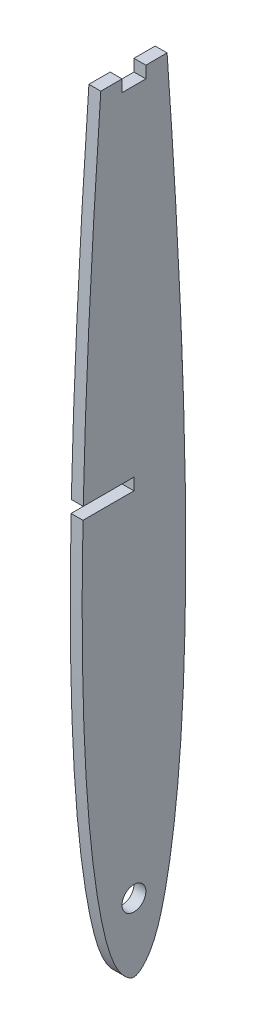
from build123d import *

# Parameters (mm, degrees)
EXTRUDE_1_DEPTH         = 2
CUT_EXTRUDE_START       = -2
CUT_EXTRUDE_1_OUTLINE_R = 2
CUT_EXTRUDE_1_DEPTH     = 2


# Read off the part's stored shape, not the designer's step: 切除-拉伸1
with BuildPart() as part:
    # 草图1 → 凸台-拉伸1 (new body)
    with BuildSketch(Plane(origin=(0, 0, 0), x_dir=(0, 0, -1), z_dir=(1, 0, 0))):
        with BuildLine():
            add(Edge.make_bspline(
                [(0, 193), (-0.012288284, 193), (-0.036860363, 192.682209119), (-0.073603598, 192.460340025), (-0.134145604, 191.982517083), (-0.216837903, 191.357126895), (-0.320148772, 190.531582795), (-0.442734222, 189.535054466), (-0.583708338, 188.359470773), (-0.741224015, 187.007350916), (-0.91342743, 185.485486569), (-1.098367032, 183.794042277), (-1.295153474, 181.932788993), (-1.503001463, 179.912860559), (-1.722142684, 177.734330299), (-1.951645546, 175.397073133), (-2.189862364, 172.914023799), (-2.436037979, 170.28517003), (-2.689763937, 167.510432908), (-2.949769263, 164.606175429), (-3.216039401, 161.572442464), (-3.488047586, 158.409161795), (-3.764070677, 155.134176566), (-4.043757612, 151.747511152), (-4.326255141, 148.249059823), (-4.609441768, 144.658859051), (-4.892481807, 140.976882583), (-5.174863501, 137.20308085), (-5.454691966, 133.359174667), (-5.731636208, 129.445182711), (-6.004663443, 125.461027301), (-6.271447257, 121.429287101), (-6.531172087, 117.349948117), (-6.782917884, 113.222962102), (-7.024648371, 109.072183193), (-7.255701434, 104.897612739), (-7.474940032, 100.699220215), (-7.679991999, 96.500812992), (-7.870083896, 92.302403851), (-8.044216273, 88.103993125), (-8.200659206, 83.929344542), (-8.338917914, 79.778489584), (-8.457541038, 75.651485195), (-8.538807898, 72.228525811), (-8.592437236, 69.509703707), (-8.626639137, 67.495423053), (-8.65491323, 65.495919754), (-8.677150684, 63.511211116), (-8.693364484, 61.541315238), (-8.703342087, 59.588985896), (-8.707094981, 57.65423498), (-8.70416559, 55.737088716), (-8.694147501, 53.840077973), (-8.676636137, 51.963218651), (-8.652114277, 50.106548117), (-8.620905719, 48.272790784), (-8.583512891, 46.461970379), (-8.539492523, 44.674120145), (-8.488374712, 42.911972119), (-8.429886653, 41.175558617), (-8.364375531, 39.464915618), (-8.291893829, 37.782113513), (-8.212897106, 36.127162371), (-8.127038802, 34.500129191), (-8.034038273, 32.903290152), (-7.933854661, 31.336686835), (-7.826611275, 29.800367448), (-7.712449105, 28.296372863), (-7.591658572, 26.824726145), (-7.4640673, 25.385515918), (-7.329411875, 23.980771462), (-7.187764067, 22.610559791), (-7.039458689, 21.274927209), (-6.884625469, 19.975944864), (-6.723768994, 18.713621105), (-6.557419856, 17.487989507), (-6.385750528, 16.300272749), (-6.209456896, 15.150457547), (-6.028620184, 14.038630129), (-5.842946286, 12.966402663), (-5.653007841, 11.933787905), (-5.458792398, 10.940905593), (-5.259967948, 9.989173646), (-5.057199181, 9.078608267), (-4.84951644, 8.209636835), (-4.635268995, 7.382464783), (-4.414704057, 6.597361178), (-4.187298343, 5.854834196), (-3.951488141, 5.1553355), (-3.708306212, 4.499219664), (-3.457504838, 3.88735236), (-3.196526443, 3.319048044), (-2.927146299, 2.794798361), (-2.650818291, 2.315014682), (-2.367000425, 1.880667992), (-2.0794803, 1.491615537), (-1.792593552, 1.14703863), (-1.50916051, 0.848541142), (-1.234038339, 0.5935698), (-0.966592418, 0.382804324), (-0.705813073, 0.218534665), (-0.459755647, 0.097332853), (-0.234428055, 0.020960156), (0, -0.01036), (0.234428055, 0.020960156), (0.459755647, 0.097332853), (0.705813073, 0.218534665), (0.966592418, 0.382804324), (1.234038339, 0.5935698), (1.50916051, 0.848541142), (1.792593552, 1.14703863), (2.0794803, 1.491615537), (2.367000425, 1.880667992), (2.650818291, 2.315014682), (2.927146299, 2.794798361), (3.196526443, 3.319048044), (3.457504838, 3.88735236), (3.708306212, 4.499219664), (3.951488141, 5.1553355), (4.187298343, 5.854834196), (4.414704057, 6.597361178), (4.635268995, 7.382464783), (4.84951644, 8.209636835), (5.057199181, 9.078608267), (5.259967948, 9.989173646), (5.458792398, 10.940905593), (5.653007841, 11.933787905), (5.842946286, 12.966402663), (6.028620184, 14.038630129), (6.209456896, 15.150457547), (6.385750528, 16.300272749), (6.557419856, 17.487989507), (6.723768994, 18.713621105), (6.884625469, 19.975944864), (7.039458689, 21.274927209), (7.187764067, 22.610559791), (7.329411875, 23.980771462), (7.4640673, 25.385515918), (7.591658572, 26.824726145), (7.712449105, 28.296372863), (7.826611275, 29.800367448), (7.933854661, 31.336686835), (8.034038273, 32.903290152), (8.127038802, 34.500129191), (8.212897106, 36.127162371), (8.291893829, 37.782113513), (8.364375531, 39.464915618), (8.429886653, 41.175558617), (8.488374712, 42.911972119), (8.539492523, 44.674120145), (8.583512891, 46.461970379), (8.620905719, 48.272790784), (8.652114277, 50.106548117), (8.676636137, 51.963218651), (8.694147501, 53.840077973), (8.70416559, 55.737088716), (8.707094981, 57.65423498), (8.703342087, 59.588985896), (8.693364484, 61.541315238), (8.677150684, 63.511211116), (8.65491323, 65.495919754), (8.626639137, 67.495423053), (8.592437236, 69.509703707), (8.538807898, 72.228525811), (8.457541038, 75.651485195), (8.338917914, 79.778489584), (8.200659206, 83.929344542), (8.044216273, 88.103993125), (7.870083896, 92.302403851), (7.679991999, 96.500812992), (7.474940032, 100.699220215), (7.255701434, 104.897612739), (7.024648371, 109.072183193), (6.782917884, 113.222962102), (6.531172087, 117.349948117), (6.271447257, 121.429287101), (6.004663443, 125.461027301), (5.731636208, 129.445182711), (5.454691966, 133.359174667), (5.174863501, 137.20308085), (4.892481807, 140.976882583), (4.609441768, 144.658859051), (4.326255141, 148.249059823), (4.043757612, 151.747511152), (3.764070677, 155.134176566), (3.488047586, 158.409161795), (3.216039401, 161.572442464), (2.949769263, 164.606175429), (2.689763937, 167.510432908), (2.436037979, 170.28517003), (2.189862364, 172.914023799), (1.951645546, 175.397073133), (1.722142684, 177.734330299), (1.503001463, 179.912860559), (1.295153474, 181.932788993), (1.098367032, 183.794042277), (0.91342743, 185.485486569), (0.741224015, 187.007350916), (0.583708338, 188.359470773), (0.442734222, 189.535054466), (0.320148772, 190.531582795), (0.216837903, 191.357126895), (0.134145604, 191.982517083), (0.073603598, 192.460340025), (0.036860363, 192.682209119), (0.012288284, 193), (0, 193)],
                knots=[0, 0, 0, 0, 0.000711186, 0.001422112, 0.002133252, 0.004251581, 0.006369198, 0.008487526, 0.011973078, 0.015457521, 0.018943038, 0.023734754, 0.028524887, 0.033316573, 0.039329174, 0.045339833, 0.051352399, 0.058485874, 0.06561704, 0.072750533, 0.080878992, 0.089004858, 0.097133325, 0.106119171, 0.115102078, 0.124087938, 0.133776582, 0.143462084, 0.153150736, 0.163374861, 0.173595632, 0.183819726, 0.194405238, 0.20498727, 0.215572756, 0.226336088, 0.237095883, 0.247859171, 0.25861711, 0.269371511, 0.28012949, 0.290699718, 0.301266554, 0.311836761, 0.316994414, 0.322150426, 0.327308111, 0.332351582, 0.337393397, 0.342436877, 0.347345125, 0.352251772, 0.357160037, 0.361913828, 0.366666143, 0.371419983, 0.375998605, 0.380575696, 0.385154319, 0.389537078, 0.393918407, 0.398301185, 0.402472485, 0.406642416, 0.410813696, 0.4147565, 0.418698025, 0.422640862, 0.426339932, 0.430037815, 0.433736878, 0.437177346, 0.44061666, 0.444057116, 0.447223686, 0.450389262, 0.45355583, 0.4564397, 0.459322619, 0.462206438, 0.464796512, 0.467385721, 0.469975829, 0.472263129, 0.474549689, 0.476836911, 0.478824757, 0.480812048, 0.482800105, 0.484492893, 0.486185006, 0.487877314, 0.489293868, 0.490710107, 0.49212745, 0.493276037, 0.494423523, 0.495568649, 0.496434714, 0.497302284, 0.498179926, 0.498796407, 0.499405099, 0.5, 0.500594901, 0.501203593, 0.501820074, 0.502697716, 0.503565286, 0.504431351, 0.505576477, 0.506723963, 0.50787255, 0.509289893, 0.510706132, 0.512122686, 0.513814994, 0.515507107, 0.517199895, 0.519187952, 0.521175243, 0.523163089, 0.525450311, 0.527736871, 0.530024171, 0.532614279, 0.535203488, 0.537793562, 0.540677381, 0.5435603, 0.54644417, 0.549610738, 0.552776314, 0.555942884, 0.55938334, 0.562822654, 0.566263122, 0.569962185, 0.573660068, 0.577359138, 0.581301975, 0.5852435, 0.589186304, 0.593357584, 0.597527515, 0.601698815, 0.606081593, 0.610462922, 0.614845681, 0.619424304, 0.624001395, 0.628580017, 0.633333857, 0.638086172, 0.642839963, 0.647748228, 0.652654875, 0.657563123, 0.662606603, 0.667648418, 0.672691889, 0.677849574, 0.683005586, 0.688163239, 0.698733446, 0.709300282, 0.71987051, 0.730628489, 0.74138289, 0.752140829, 0.762904117, 0.773663912, 0.784427244, 0.79501273, 0.805594762, 0.816180274, 0.826404368, 0.836625139, 0.846849264, 0.856537916, 0.866223418, 0.875912062, 0.884897922, 0.893880829, 0.902866675, 0.910995142, 0.919121008, 0.927249467, 0.93438296, 0.941514126, 0.948647601, 0.954660167, 0.960670826, 0.966683427, 0.971475113, 0.976265246, 0.981056962, 0.984542479, 0.988026922, 0.991512474, 0.993630802, 0.995748419, 0.997866748, 0.998577888, 0.999288814, 1, 1, 1, 1], degree=3))
        make_face()
    extrude(amount=EXTRUDE_1_DEPTH)

    # 切除-拉伸1 outline → 切除-拉伸1 (cut)
    with BuildSketch(Plane(origin=(2, 0, 0), x_dir=(0, 0, -1), z_dir=(1, 0, 0)).offset(CUT_EXTRUDE_START)):
        with BuildLine():
            Line((0, 72.763840152), (-8.524733292, 72.763840152))
            add(Edge.make_bspline(
                [(-8.524733292, 72.763840152), (-8.53409331, 72.350520598), (-8.548661876, 71.683860649), (-8.562358996, 71.017182624), (-8.567436088, 70.763840152)],
                knots=[0.308661766, 0.308661766, 0.308661766, 0.308661766, 0.311836761, 0.313782754, 0.313782754, 0.313782754, 0.313782754], degree=3))
            Line((-8.567436088, 70.763840152), (0, 70.763840152))
            Line((0, 70.763840152), (0, 72.763840152))
        make_face()
        with BuildLine():
            add(Edge.make_bspline(
                [(0, 193), (-0.012288284, 193), (-0.036860363, 192.682209119), (-0.073603598, 192.460340025), (-0.134145604, 191.982517083), (-0.216837903, 191.357126895), (-0.320148772, 190.531582795), (-0.442734222, 189.535054466), (-0.583708338, 188.359470773), (-0.741224015, 187.007350916), (-0.91342743, 185.485486569), (-1.098367032, 183.794042277), (-1.295153474, 181.932788993), (-1.503001463, 179.912860559), (-1.722142684, 177.734330299), (-1.951645546, 175.397073133), (-2.189862364, 172.914023799), (-2.436037979, 170.28517003), (-2.689763937, 167.510432908), (-2.949769263, 164.606175429), (-3.216039401, 161.572442464), (-3.488047586, 158.409161795), (-3.764070677, 155.134176566), (-4.043757612, 151.747511152), (-4.326255141, 148.249059823), (-4.609441768, 144.658859051), (-4.892481807, 140.976882583), (-5.174863501, 137.20308085), (-5.399572783, 134.116327682), (-5.530087414, 132.287234714), (-5.570547263, 131.716510892)],
                knots=[0, 0, 0, 0, 0.000711186, 0.001422112, 0.002133252, 0.004251581, 0.006369198, 0.008487526, 0.011973078, 0.015457521, 0.018943038, 0.023734754, 0.028524887, 0.033316573, 0.039329174, 0.045339833, 0.051352399, 0.058485874, 0.06561704, 0.072750533, 0.080878992, 0.089004858, 0.097133325, 0.106119171, 0.115102078, 0.124087938, 0.133776582, 0.143462084, 0.153150736, 0.157544743, 0.157544743, 0.157544743, 0.157544743], degree=3))
            Line((-5.570547263, 131.716510892), (-2, 131.716510892))
            Line((-2, 131.716510892), (-2, 129.716510892))
            Line((-2, 129.716510892), (2, 129.716510892))
            Line((2, 129.716510892), (2, 131.716510892))
            Line((2, 131.716510892), (5.570547263, 131.716510892))
            add(Edge.make_bspline(
                [(5.570547263, 131.716510892), (5.530087414, 132.287234714), (5.399572783, 134.116327682), (5.174863501, 137.20308085), (4.892481807, 140.976882583), (4.609441768, 144.658859051), (4.326255141, 148.249059823), (4.043757612, 151.747511152), (3.764070677, 155.134176566), (3.488047586, 158.409161795), (3.216039401, 161.572442464), (2.949769263, 164.606175429), (2.689763937, 167.510432908), (2.436037979, 170.28517003), (2.189862364, 172.914023799), (1.951645546, 175.397073133), (1.722142684, 177.734330299), (1.503001463, 179.912860559), (1.295153474, 181.932788993), (1.098367032, 183.794042277), (0.91342743, 185.485486569), (0.741224015, 187.007350916), (0.583708338, 188.359470773), (0.442734222, 189.535054466), (0.320148772, 190.531582795), (0.216837903, 191.357126895), (0.134145604, 191.982517083), (0.073603598, 192.460340025), (0.036860363, 192.682209119), (0.012288284, 193), (0, 193)],
                knots=[0.842455257, 0.842455257, 0.842455257, 0.842455257, 0.846849264, 0.856537916, 0.866223418, 0.875912062, 0.884897922, 0.893880829, 0.902866675, 0.910995142, 0.919121008, 0.927249467, 0.93438296, 0.941514126, 0.948647601, 0.954660167, 0.960670826, 0.966683427, 0.971475113, 0.976265246, 0.981056962, 0.984542479, 0.988026922, 0.991512474, 0.993630802, 0.995748419, 0.997866748, 0.998577888, 0.999288814, 1, 1, 1, 1], degree=3))
        make_face()
        with Locations((0, 11.490063794)):
            Circle(CUT_EXTRUDE_1_OUTLINE_R)
    extrude(amount=CUT_EXTRUDE_1_DEPTH, mode=Mode.SUBTRACT)


solid = part.part
